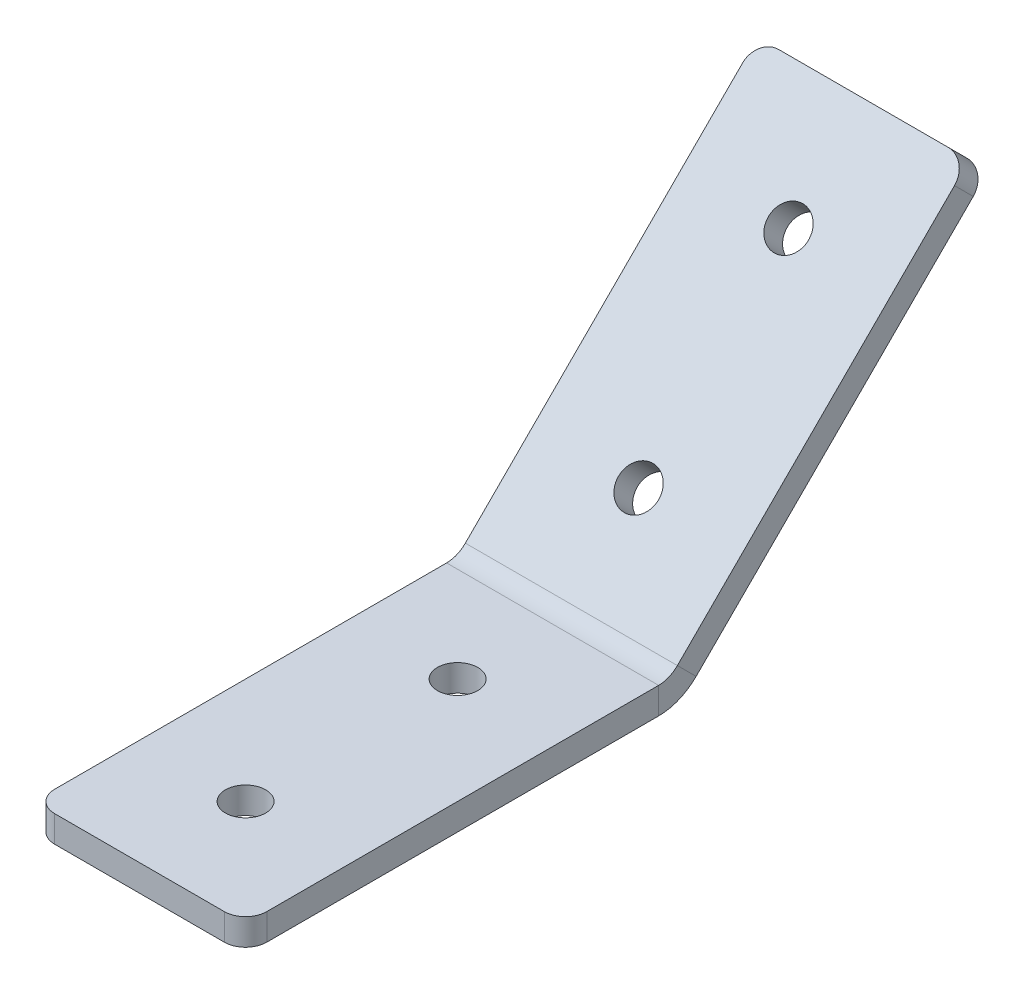
from build123d import *

# Parameters (mm, degrees)
BOSS_EXTRUDE1_DEPTH    = 25.4
CUT_EXTRUDE1_REACH     = 101.249
SKETCH2_R              = 2.413
CUT_EXTRUDE2_REACH     = 96.062
SKETCH3_R              = 2.413
CONVERT_SOLID1_DEPTH   = 25.4
CONVERT_SOLID1_2_DEPTH = 25.4
FILLET1_R              = 2.54


# Read off the part's stored shape, not the designer's step: Convert-Solid1
with BuildPart() as part:
    # Sketch1 → Boss-Extrude1 (new body)
    with BuildSketch(Plane(origin=(0, 0, 0), x_dir=(0, 0, -1), z_dir=(1, 0, 0))):
        Polygon((0, 0), (52.115128061, 0), (88.966088515, 36.850960454), (86.721024484, 39.096024484), (50.8, 3.175), (0, 3.175), align=None)
    extrude(amount=BOSS_EXTRUDE1_DEPTH)

    # Sketch2 → Cut-Extrude1 (cut, up to next)
    with BuildSketch(Plane(origin=(0, 3.175, 0), x_dir=(1, 0, 0), z_dir=(0, 1, 0)), mode=Mode.PRIVATE) as cut_extrude1_sk1:
        with Locations(Location((12.7, 12.7, 0), (0, 0, 270))):
            Circle(SKETCH2_R)
    cut_extrude1_tool1 = extrude(cut_extrude1_sk1.sketch, amount=-CUT_EXTRUDE1_REACH, mode=Mode.PRIVATE) & part.part
    # Sketch2 → Cut-Extrude1 (cut, up to next)
    with BuildSketch(Plane(origin=(0, 3.175, 0), x_dir=(1, 0, 0), z_dir=(0, 1, 0)), mode=Mode.PRIVATE) as cut_extrude1_sk2:
        with Locations(Location((12.7, 38.1, 0), (0, 0, 270))):
            Circle(SKETCH2_R)
    cut_extrude1_tool2 = extrude(cut_extrude1_sk2.sketch, amount=-CUT_EXTRUDE1_REACH, mode=Mode.PRIVATE) & part.part
    add(cut_extrude1_tool1.solids().sort_by_distance((12.7, 3.175, -12.7))[0], mode=Mode.SUBTRACT)
    add(cut_extrude1_tool2.solids().sort_by_distance((12.7, 3.175, -38.1))[0], mode=Mode.SUBTRACT)

    # Sketch3 → Cut-Extrude2 (cut, up to next)
    with BuildSketch(Plane(origin=(0, -23.8125, -23.8125), x_dir=(1, 0, 0), z_dir=(0, 0.707106781186546, 0.707106781186549)), mode=Mode.PRIVATE) as cut_extrude2_sk1:
        with Locations(Location((12.7, 76.266088515, 0), (0, 0, 270))):
            Circle(SKETCH3_R)
    cut_extrude2_tool1 = extrude(cut_extrude2_sk1.sketch, amount=-CUT_EXTRUDE2_REACH, mode=Mode.PRIVATE) & part.part
    # Sketch3 → Cut-Extrude2 (cut, up to next)
    with BuildSketch(Plane(origin=(0, -23.8125, -23.8125), x_dir=(1, 0, 0), z_dir=(0, 0.707106781186546, 0.707106781186549)), mode=Mode.PRIVATE) as cut_extrude2_sk2:
        with Locations(Location((12.7, 50.866088515, 0), (0, 0, 270))):
            Circle(SKETCH3_R)
    cut_extrude2_tool2 = extrude(cut_extrude2_sk2.sketch, amount=-CUT_EXTRUDE2_REACH, mode=Mode.PRIVATE) & part.part
    add(cut_extrude2_tool1.solids().sort_by_distance((12.7, 30.115768, -77.740768))[0], mode=Mode.SUBTRACT)
    add(cut_extrude2_tool2.solids().sort_by_distance((12.7, 12.155256, -59.780256))[0], mode=Mode.SUBTRACT)

    # Convert-Solid1 outline → Convert-Solid1 (cut)
    with BuildSketch(Plane.YZ):
        with BuildLine():
            Line((0, -52.115128061), (1.859871939, -53.975))
            ThreePointArc((1.859871939, -53.975), (0.483364969, -51.914911734), (0, -49.484871939))
            Line((0, -49.484871939), (0, -52.115128061))
        make_face()
    extrude(amount=CONVERT_SOLID1_DEPTH, mode=Mode.SUBTRACT)

    # Convert-Solid1 2 outline → Convert-Solid1 2 (add)
    with BuildSketch(Plane.YZ):
        with BuildLine():
            Line((3.175, -50.8), (4.10493597, -51.72993597))
            ThreePointArc((4.10493597, -51.72993597), (3.416682484, -50.699891837), (3.175, -49.484871939))
            Line((3.175, -49.484871939), (3.175, -50.8))
        make_face()
    extrude(amount=CONVERT_SOLID1_2_DEPTH)

    # Fillet1
    fillet1_edges = [part.edges().sort_by_distance(p)[0] for p in [
        (0, 1.5875, 0),
        (25.4, 1.5875, 0),
        (25.4, 37.973492469, -87.843556499),
        (0, 37.973492469, -87.843556499),
    ]]
    fillet(fillet1_edges, radius=FILLET1_R)


solid = part.part
